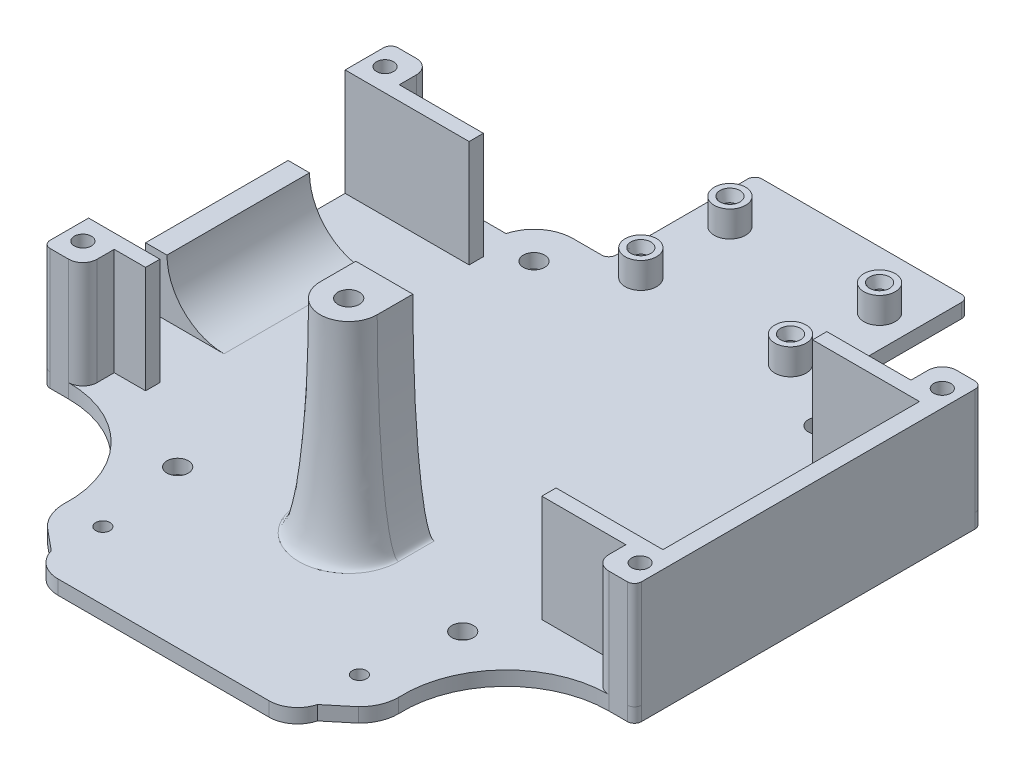
from build123d import *
from OCP.BRepFilletAPI import BRepFilletAPI_MakeChamfer, BRepFilletAPI_MakeFillet

# Parameters (mm, degrees)
SKETCH1_W           = 83
SKETCH1_H           = 98
SKETCH1_R           = 1.5
BOSS_EXTRUDE1_DEPTH = 2
FILLET1_R           = 5
SKETCH4_R           = 1.2
BOSS_EXTRUDE3_DEPTH = 15
FILLET2_R1          = 2
FILLET2_R2          = 1
CUT_EXTRUDE1_DEPTH  = 15
SKETCH7_R           = 2.2
BOSS_EXTRUDE4_DEPTH = 3.65
SKETCH8_R           = 1
CUT_EXTRUDE2_DEPTH  = 129.925647177
CHAMFER2_SIZE       = 0.4
CHAMFER2_SIZE2      = 1.492820323
SKETCH9_R           = 1
CUT_EXTRUDE3_DEPTH  = 3.65
SKETCH10_W          = 3
SKETCH10_H          = 20
BOSS_EXTRUDE5_DEPTH = 8
CUT_EXTRUDE4_DEPTH  = 4
FILLET4_R           = 1
SKETCH12_W          = 83
SKETCH12_H          = 48.8
CUT_EXTRUDE5_DEPTH  = 15
SKETCH13_R          = 1.2
BOSS_EXTRUDE6_DEPTH = 15
SKETCH14_R          = 1.2
BOSS_EXTRUDE7_DEPTH = 15
SKETCH15_W          = 3
SKETCH15_H          = 20
BOSS_EXTRUDE8_DEPTH = 8
FILLET5_R           = 8
FILLET6_R1          = 2
FILLET6_R2          = 1
SKETCH17_R          = 1.5
BOSS_EXTRUDE9_DEPTH = 28.5
FILLET8_SIZE        = 3
FILLET8_SIZE_2      = 28.5


# Some blends are built 0.0001 mm under size
with BuildPart() as part:
    # Sketch1 → Boss-Extrude1 (new body)
    with BuildSketch(Plane(origin=(0, 0, 0), x_dir=(1, 0, 0), z_dir=(0, 1, 0))):
        with Locations((41.5, 49)):
            Rectangle(SKETCH1_W, SKETCH1_H)
        with Locations(Location((21.5, 72, 0), (0, 0, 270))):
            Circle(SKETCH1_R, mode=Mode.SUBTRACT)
        with Locations(Location((61.5, 72, 0), (0, 0, 270))):
            Circle(SKETCH1_R, mode=Mode.SUBTRACT)
        with Locations(Location((61.5, 22, 0), (0, 0, 270))):
            Circle(SKETCH1_R, mode=Mode.SUBTRACT)
        with Locations(Location((21.5, 22, 0), (0, 0, 270))):
            Circle(SKETCH1_R, mode=Mode.SUBTRACT)
    extrude(amount=BOSS_EXTRUDE1_DEPTH)

    # Fillet1
    fillet1_edges = [part.edges().sort_by_distance(p)[0] for p in [
        (0, 1, -98),
        (83, 1, -98),
        (83, 1, 0),
        (0, 1, 0),
    ]]
    fillet(fillet1_edges, radius=FILLET1_R)

    # Sketch4 → Boss-Extrude3 (add)
    # profile 1 of 3: a face of its own
    with BuildSketch(Plane(origin=(0, 2, 0), x_dir=(1, 0, 0), z_dir=(0, 1, 0))):
        Polygon((2.4, 67), (2.4, 31), (17.4, 31), (17.4, 29), (5.6, 29), (5.6, 24.6), (0, 24.6), (0, 29), (0, 69), (0, 73.4), (5.6, 73.4), (5.6, 69), (17.4, 69), (17.4, 67), align=None)
        with Locations(Location((2.4, 70.2, 0), (0, 0, 270))):
            Circle(SKETCH4_R, mode=Mode.SUBTRACT)
        with Locations(Location((2.4, 27.8, 0), (0, 0, 270))):
            Circle(SKETCH4_R, mode=Mode.SUBTRACT)
    # profile 2 of 3: a face of its own
    with BuildSketch(Plane(origin=(0, 2, 0), x_dir=(1, 0, 0), z_dir=(0, 1, 0))):
        Polygon((77.4, 69), (65.6, 69), (65.6, 67), (80.6, 67), (83, 67), (83, 69), (83, 73.4), (77.4, 73.4), align=None)
        with Locations(Location((80.6, 70.2, 0), (0, 0, 90))):
            Circle(SKETCH4_R, mode=Mode.SUBTRACT)
    # profile 3 of 3: a face of its own
    with BuildSketch(Plane(origin=(0, 2, 0), x_dir=(1, 0, 0), z_dir=(0, 1, 0))):
        Polygon((77.4, 29), (65.6, 29), (65.6, 31), (80.6, 31), (83, 31), (83, 29), (83, 24.6), (77.4, 24.6), align=None)
        with Locations(Location((80.6, 27.8, 0), (0, 0, 90))):
            Circle(SKETCH4_R, mode=Mode.SUBTRACT)
    extrude(amount=BOSS_EXTRUDE3_DEPTH)

    # Fillet2: one fillet with a radius per group of edges: ONE call of the kernel's fillet builder (fillet() takes one radius for all edges)
    fillet2_edges_1 = [part.edges().sort_by_distance(p)[0] for p in [
        (5.6, 9.5, -24.6),
        (5.6, 9.5, -73.4),
        (77.4, 9.5, -73.4),
        (77.4, 9.5, -24.6),
    ]]
    fillet2_edges_2 = [part.edges().sort_by_distance(p)[0] for p in [
        (0, 9.5, -73.4),
        (0, 9.5, -24.6),
        (83, 9.5, -73.4),
        (83, 9.5, -24.6),
    ]]
    fillet2 = BRepFilletAPI_MakeFillet(part.part.solid().wrapped)
    for e in fillet2_edges_1:
        fillet2.Add(FILLET2_R1, e.wrapped)
    for e in fillet2_edges_2:
        fillet2.Add(FILLET2_R2, e.wrapped)
    add(Compound.cast(fillet2.Shape()), mode=Mode.REPLACE)

    # Sketch6 → Cut-Extrude1 (cut)
    with BuildSketch(Plane(origin=(0, 2, 0), x_dir=(1, 0, 0), z_dir=(0, 1, 0))):
        with BuildLine():
            Line((19.685054688, 5.53815797), (22.817482984, 2.941906208))
            ThreePointArc((22.817482984, 2.941906208), (24.24934289, 0.819404524), (26.675, 0))
            Line((26.675, 0), (56.325, 0))
            ThreePointArc((56.325, 0), (58.75065711, 0.819404524), (60.182517016, 2.941906208))
            Line((60.182517016, 2.941906208), (63.314945312, 5.53815797))
            ThreePointArc((63.314945312, 5.53815797), (64.561234988, 7.347350379), (65, 9.5))
            ThreePointArc((65, 9.5), (68.9672391, 20.132897812), (79.4, 24.6))
            Line((79.4, 24.6), (82, 24.6))
            ThreePointArc((82, 24.6), (82.707106781, 24.892893219), (83, 25.6))
            Line((83, 25.6), (83, -9.4))
            Line((83, -9.4), (0, -9.4))
            Line((0, -9.4), (0, 25.6))
            ThreePointArc((0, 25.6), (0.292893219, 24.892893219), (1, 24.6))
            Line((1, 24.6), (3.6, 24.6))
            ThreePointArc((3.6, 24.6), (14.0327609, 20.132897812), (18, 9.5))
            ThreePointArc((18, 9.5), (18.438765012, 7.347350379), (19.685054688, 5.53815797))
        make_face()
    extrude(amount=-CUT_EXTRUDE1_DEPTH, mode=Mode.SUBTRACT)

    # Sketch7 → Boss-Extrude4 (add)
    with BuildSketch(Plane(origin=(0, 2, 0), x_dir=(1, 0, 0), z_dir=(0, 1, 0))):
        with Locations(Location((31, 90, 0), (0, 0, 90))):
            Circle(SKETCH7_R)
        with Locations(Location((52, 90, 0), (0, 0, 90))):
            Circle(SKETCH7_R)
        with Locations(Location((52, 77.5, 0), (0, 0, 90))):
            Circle(SKETCH7_R)
        with Locations(Location((31, 77.5, 0), (0, 0, 90))):
            Circle(SKETCH7_R)
    extrude(amount=BOSS_EXTRUDE4_DEPTH)

    # Sketch8 → Cut-Extrude2 (cut, through all)
    with BuildSketch(Plane(origin=(0, 5.65, 0), x_dir=(1, 0, 0), z_dir=(0, 1, 0))):
        with Locations(Location((31, 77.5, 0), (0, 0, 270))):
            Circle(SKETCH8_R)
        with Locations(Location((52, 77.5, 0), (0, 0, 270))):
            Circle(SKETCH8_R)
        with Locations(Location((52, 90, 0), (0, 0, 270))):
            Circle(SKETCH8_R)
        with Locations(Location((31, 90, 0), (0, 0, 270))):
            Circle(SKETCH8_R)
    extrude(amount=-CUT_EXTRUDE2_DEPTH, mode=Mode.SUBTRACT)

    # Chamfer2: one chamfer whose edges measure the first distance from different faces: ONE call of the kernel's chamfer builder (chamfer() names one face for all edges)
    chamfer2_edges_1 = [part.edges().sort_by_distance(p)[0] for p in [
        (31, 5.65, -91),
    ]]
    chamfer2_side_1 = [part.faces().sort_by_distance(p)[0] for p in [
        (31, 5.65, -87.862225397),
    ]]
    chamfer2_edges_2 = [part.edges().sort_by_distance(p)[0] for p in [
        (52, 5.65, -91),
    ]]
    chamfer2_side_2 = [part.faces().sort_by_distance(p)[0] for p in [
        (52, 5.65, -87.862225397),
    ]]
    chamfer2_edges_3 = [part.edges().sort_by_distance(p)[0] for p in [
        (52, 5.65, -78.5),
    ]]
    chamfer2_side_3 = [part.faces().sort_by_distance(p)[0] for p in [
        (52, 5.65, -75.362225397),
    ]]
    chamfer2_edges_4 = [part.edges().sort_by_distance(p)[0] for p in [
        (31, 5.65, -78.5),
    ]]
    chamfer2_side_4 = [part.faces().sort_by_distance(p)[0] for p in [
        (31, 5.65, -75.362225397),
    ]]
    chamfer2 = BRepFilletAPI_MakeChamfer(part.part.solid().wrapped)
    for e in chamfer2_edges_1:
        chamfer2.Add(CHAMFER2_SIZE, CHAMFER2_SIZE2, e.wrapped, chamfer2_side_1[0].wrapped)  # the first distance lies on this face
    for e in chamfer2_edges_2:
        chamfer2.Add(CHAMFER2_SIZE, CHAMFER2_SIZE2, e.wrapped, chamfer2_side_2[0].wrapped)  # the first distance lies on this face
    for e in chamfer2_edges_3:
        chamfer2.Add(CHAMFER2_SIZE, CHAMFER2_SIZE2, e.wrapped, chamfer2_side_3[0].wrapped)  # the first distance lies on this face
    for e in chamfer2_edges_4:
        chamfer2.Add(CHAMFER2_SIZE, CHAMFER2_SIZE2, e.wrapped, chamfer2_side_4[0].wrapped)  # the first distance lies on this face
    add(Compound.cast(chamfer2.Shape()), mode=Mode.REPLACE)

    # Sketch9 → Cut-Extrude3 (cut)
    with BuildSketch(Plane(origin=(0, 2, 0), x_dir=(1, 0, 0), z_dir=(0, 1, 0))):
        with Locations(Location((23.5, 9.5, 0), (0, 0, 270))):
            Circle(SKETCH9_R)
        with Locations(Location((59.5, 9.5, 0), (0, 0, 270))):
            Circle(SKETCH9_R)
    extrude(amount=-CUT_EXTRUDE3_DEPTH, mode=Mode.SUBTRACT)

    # Sketch10 → Boss-Extrude5 (add)
    with BuildSketch(Plane(origin=(0, 2, 0), x_dir=(1, 0, 0), z_dir=(0, 1, 0))):
        with Locations((81.5, 49)):
            Rectangle(SKETCH10_W, SKETCH10_H)
    extrude(amount=BOSS_EXTRUDE5_DEPTH)

    # Sketch11 → Cut-Extrude4 (cut)
    with BuildSketch(Plane(origin=(0, 2, 0), x_dir=(1, 0, 0), z_dir=(0, 1, 0))):
        with BuildLine():
            Line((0, 93), (0, 72.4))
            ThreePointArc((0, 72.4), (0.292893219, 73.107106781), (1, 73.4))
            Line((1, 73.4), (3.6, 73.4))
            Line((3.6, 73.4), (16.181165541, 73.4))
            ThreePointArc((16.181165541, 73.4), (18.142173322, 76.356030303), (21.5, 77.5))
            Line((21.5, 77.5), (26.5, 77.5))
            Line((26.5, 77.5), (26.5, 98))
            Line((26.5, 98), (5, 98))
            ThreePointArc((5, 98), (1.464466094, 96.535533906), (0, 93))
        make_face()
        with BuildLine():
            Line((78, 98), (56.5, 98))
            Line((56.5, 98), (56.5, 77.5))
            Line((56.5, 77.5), (61.5, 77.5))
            ThreePointArc((61.5, 77.5), (64.857826678, 76.356030303), (66.818834459, 73.4))
            Line((66.818834459, 73.4), (79.4, 73.4))
            Line((79.4, 73.4), (82, 73.4))
            ThreePointArc((82, 73.4), (82.707106781, 73.107106781), (83, 72.4))
            Line((83, 72.4), (83, 93))
            ThreePointArc((83, 93), (81.535533906, 96.535533906), (78, 98))
        make_face()
    extrude(amount=-CUT_EXTRUDE4_DEPTH, mode=Mode.SUBTRACT)

    # Fillet4
    fillet4_edges = [part.edges().sort_by_distance(p)[0] for p in [
        (26.5, 1, -98),
        (26.5, 1, -77.5),
        (56.5, 1, -77.5),
        (56.5, 1, -98),
    ]]
    fillet(fillet4_edges, radius=FILLET4_R)

    # Sketch12 → Cut-Extrude5 (cut)
    with BuildSketch(Plane(origin=(0, 17, 0), x_dir=(1, 0, 0), z_dir=(0, 1, 0))):
        with Locations((41.5, 49)):
            Rectangle(SKETCH12_W, SKETCH12_H)
    extrude(amount=-CUT_EXTRUDE5_DEPTH, mode=Mode.SUBTRACT)

    # Sketch13 → Boss-Extrude6 (add)
    with BuildSketch(Plane(origin=(0, 2, 0), x_dir=(1, 0, 0), z_dir=(0, 1, 0))):
        Polygon((83, 29), (83, 24.6), (77.4, 24.6), (77.4, 29), (65.6, 29), (65.6, 31), (80.6, 31), (80.6, 67), (65.6, 67), (65.6, 69), (77.4, 69), (77.4, 73.4), (83, 73.4), (83, 69), align=None)
        with Locations(Location((80.6, 70.2, 0), (0, 0, 90))):
            Circle(SKETCH13_R, mode=Mode.SUBTRACT)
        with Locations(Location((80.6, 27.8, 0), (0, 0, 90))):
            Circle(SKETCH13_R, mode=Mode.SUBTRACT)
    extrude(amount=BOSS_EXTRUDE6_DEPTH)

    # Sketch14 → Boss-Extrude7 (add)
    # profile 1 of 2: a face of its own
    with BuildSketch(Plane(origin=(0, 2, 0), x_dir=(1, 0, 0), z_dir=(0, 1, 0))):
        Polygon((10, 29), (5.6, 29), (5.6, 24.6), (0, 24.6), (0, 29), (0, 31), (2.4, 31), (10, 31), align=None)
        with Locations(Location((2.4, 27.8, 0), (0, 0, 90))):
            Circle(SKETCH14_R, mode=Mode.SUBTRACT)
    # profile 2 of 2: a face of its own
    with BuildSketch(Plane(origin=(0, 2, 0), x_dir=(1, 0, 0), z_dir=(0, 1, 0))):
        Polygon((17.4, 69), (17.4, 67), (2.4, 67), (0, 67), (0, 69), (0, 73.4), (5.6, 73.4), (5.6, 69), align=None)
        with Locations(Location((2.4, 70.2, 0), (0, 0, 90))):
            Circle(SKETCH14_R, mode=Mode.SUBTRACT)
    extrude(amount=BOSS_EXTRUDE7_DEPTH)

    # Sketch15 → Boss-Extrude8 (add)
    with BuildSketch(Plane(origin=(0, 2, 0), x_dir=(1, 0, 0), z_dir=(0, 1, 0))):
        with Locations((1.5, 49)):
            Rectangle(SKETCH15_W, SKETCH15_H)
    extrude(amount=BOSS_EXTRUDE8_DEPTH)

    # Fillet5
    fillet5_edges = [part.edges().sort_by_distance(p)[0] for p in [
        (3, 2, -49),
    ]]
    fillet(fillet5_edges, radius=FILLET5_R - 0.0001)  # a hair under: the kernel refuses the full size

    # Fillet6: one fillet with a radius per group of edges: ONE call of the kernel's fillet builder (fillet() takes one radius for all edges)
    fillet6_edges_1 = [part.edges().sort_by_distance(p)[0] for p in [
        (5.6, 9.5, -24.6),
        (5.6, 9.5, -73.4),
        (77.4, 9.5, -73.4),
        (77.4, 9.5, -24.6),
    ]]
    fillet6_edges_2 = [part.edges().sort_by_distance(p)[0] for p in [
        (0, 9.5, -73.4),
        (0, 9.5, -24.6),
        (83, 9.5, -24.6),
        (83, 9.5, -73.4),
    ]]
    fillet6 = BRepFilletAPI_MakeFillet(part.part.solid().wrapped)
    for e in fillet6_edges_1:
        fillet6.Add(FILLET6_R1, e.wrapped)
    for e in fillet6_edges_2:
        fillet6.Add(FILLET6_R2, e.wrapped)
    add(Compound.cast(fillet6.Shape()), mode=Mode.REPLACE)

    # Sketch17 → Boss-Extrude9 (add)
    with BuildSketch(Plane(origin=(0, 2, 0), x_dir=(1, 0, 0), z_dir=(0, 1, 0))):
        with BuildLine():
            Line((45.5, 31), (37.5, 31))
            Line((37.5, 31), (37.5, 26))
            ThreePointArc((37.5, 26), (41.5, 22), (45.5, 26))
            Line((45.5, 26), (45.5, 31))
        make_face()
        with Locations(Location((41.5, 26, 0), (0, 0, 90))):
            Circle(SKETCH17_R, mode=Mode.SUBTRACT)
    extrude(amount=BOSS_EXTRUDE9_DEPTH)

    # Fillet8
    # an asymmetric fillet: 28.5, 3 mm, written as the material it adds along each edge
    with BuildSketch(Plane(origin=(37.5, 2, -31), x_dir=(-1, 0, 0), z_dir=(0, 0, 1)), Plane(origin=(45.5, 2, -26), x_dir=(1, 0, 0), z_dir=(0, 0, -1))) as fillet8_piece_1:
        with BuildLine():
            Bezier((FILLET8_SIZE, 0), (0, 0), (0, -FILLET8_SIZE_2), weights=[1, 0.707106781, 1])
            Line((0, -FILLET8_SIZE_2), (0, 0))
            Line((0, 0), (FILLET8_SIZE, 0))
        make_face()
    extrude(amount=5)
    with BuildSketch(Plane(origin=(41.5, 2, -26), x_dir=(-1, 0, 0), z_dir=(0, 0, -1))) as fillet8_piece_2:
        with BuildLine():
            Bezier((4 + FILLET8_SIZE, 0), (4, 0), (4, FILLET8_SIZE_2), weights=[1, 0.707106781, 1])
            Line((4, FILLET8_SIZE_2), (4, 0))
            Line((4, 0), (4 + FILLET8_SIZE, 0))
        make_face()
    revolve(axis=Axis((41.5, 2, -26), (0, 1, 0)), revolution_arc=180)


solid = part.part
